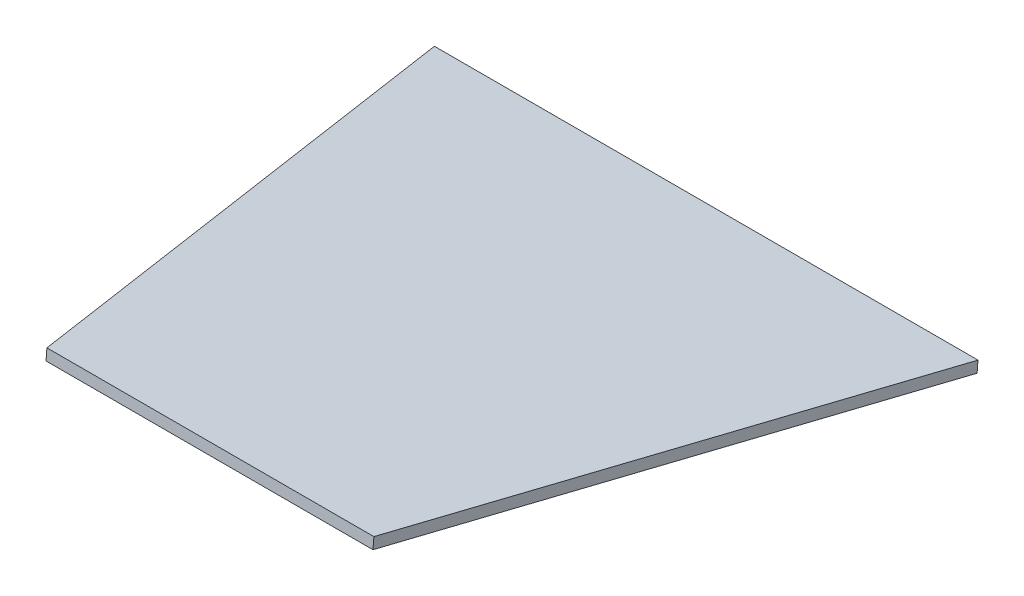
from build123d import *

# Parameters (mm, degrees)
BOSS_EXTRUDE1_DEPTH = 12.7


with BuildPart() as part:
    # Sketch1 → Boss-Extrude1 (new body)
    with BuildSketch(Plane(origin=(-0.000127053, -1585.086360496, 130.759271009), x_dir=(-0.9999999999999969, 7.96141416871426e-08, -6.567661367452002e-09), z_dir=(-7.988457756299226e-08, -0.9966146823530275, 0.08221420143970255))):
        Polygon((927.932358906, -1893.28840213), (1306.839320025, -1893.28840213), (1432.352062754, -1316.739819061), (802.419616178, -1316.739819061), align=None)
    extrude(amount=BOSS_EXTRUDE1_DEPTH)


solid = part.part
